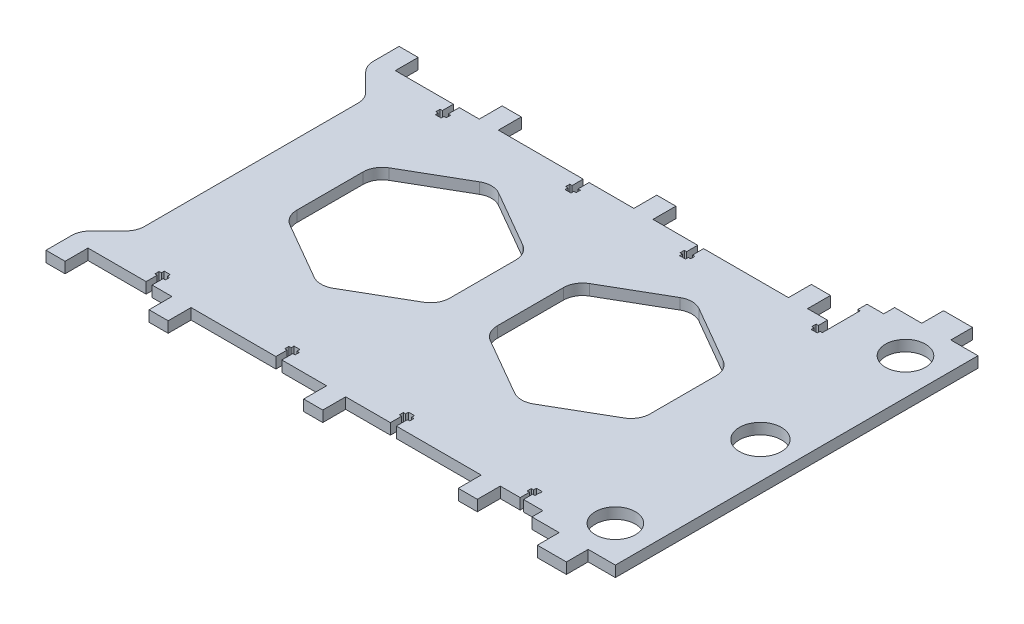
from build123d import *

# Parameters (mm, degrees)
SKETCH_1_R      = 11.052634422
SKETCH_1_R_2    = 11.578950347
EXTRUDE_1_DEPTH = 6


with BuildPart() as part:
    # Эскиз1 → Бобышка-Вытянуть1 (new body)
    with BuildSketch(Plane(origin=(0, 0, 0), x_dir=(1, 0, 0), z_dir=(0, 1, 0))):
        with BuildLine():
            Line((-137.074871228, -68.470853113), (-137.074871228, 49.124679931))
            ThreePointArc((-137.074871228, 49.124679931), (-137.876139291, 53.152928246), (-140.157958535, 56.567912278))
            Line((-140.157958535, 56.567912278), (-149.781267186, 66.191215596))
            ThreePointArc((-149.781267186, 66.191215596), (-152.063084536, 69.606198717), (-152.864352193, 73.634445267))
            Line((-152.864352193, 73.634445267), (-152.86435282, 87.695360009))
            Line((-152.86435282, 87.695360009), (-142.338028676, 87.695360009))
            Line((-142.338028676, 87.695360009), (-142.338028676, 75.063775742))
            Line((-142.338028676, 75.063775742), (-110.285395264, 75.063775742))
            Line((-110.285395264, 75.063775742), (-110.285395264, 68.95850962))
            Line((-110.285395264, 68.95850962), (-111.548551338, 68.95850962))
            Line((-111.548551338, 68.95850962), (-111.548551338, 66.642719563))
            Line((-111.548551338, 66.642719563), (-110.285395264, 66.642719563))
            Line((-110.285395264, 66.642719563), (-110.285395264, 65.063776432))
            Line((-110.285395264, 65.063776432), (-107.022236191, 65.063776432))
            Line((-107.022236191, 65.063776432), (-107.022236191, 66.642719563))
            Line((-107.022236191, 66.642719563), (-105.759080117, 66.642719563))
            Line((-105.759080117, 66.642719563), (-105.759080117, 68.95850962))
            Line((-105.759080117, 68.95850962), (-107.022236191, 68.95850962))
            Line((-107.022236191, 68.95850962), (-107.022236191, 75.063775742))
            Line((-107.022236191, 75.063775742), (-96.022235382, 75.063775742))
            Line((-96.022235382, 75.063775742), (-96.022235382, 87.695360009))
            Line((-96.022235382, 87.695360009), (-85.495911237, 87.695360009))
            Line((-85.495911237, 87.695360009), (-85.495911237, 75.063775742))
            Line((-85.495911237, 75.063775742), (-38.706429514, 75.063775742))
            Line((-38.706429514, 75.063775742), (-38.706429514, 68.95850962))
            Line((-38.706429514, 68.95850962), (-39.969585588, 68.95850962))
            Line((-39.969585588, 68.95850962), (-39.969585588, 66.642719563))
            Line((-39.969585588, 66.642719563), (-38.706429514, 66.642719563))
            Line((-38.706429514, 66.642719563), (-38.706429514, 65.063776432))
            Line((-38.706429514, 65.063776432), (-35.44326848, 65.063776432))
            Line((-35.44326848, 65.063776432), (-35.44326848, 66.642719563))
            Line((-35.44326848, 66.642719563), (-34.180110446, 66.642719563))
            Line((-34.180110446, 66.642719563), (-34.180110446, 68.95850962))
            Line((-34.180110446, 68.95850962), (-35.44326848, 68.95850962))
            Line((-35.44326848, 68.95850962), (-35.44326848, 75.063775742))
            Line((-35.44326848, 75.063775742), (-10.759052362, 75.063775742))
            Line((-10.759052362, 75.063775742), (-10.759052362, 87.695360009))
            Line((-10.759052362, 87.695360009), (-0.2327341, 87.695360009))
            Line((-0.2327341, 87.695360009), (-0.2327341, 75.063775742))
            Line((-0.2327341, 75.063775742), (24.451482019, 75.063775742))
            Line((24.451482019, 75.063775742), (24.451482019, 68.95850962))
            Line((24.451482019, 68.95850962), (23.188323984, 68.95850962))
            Line((23.188323984, 68.95850962), (23.188323984, 66.642719563))
            Line((23.188323984, 66.642719563), (24.451482019, 66.642719563))
            Line((24.451482019, 66.642719563), (24.451482019, 65.063776432))
            Line((24.451482019, 65.063776432), (27.714643053, 65.063776432))
            Line((27.714643053, 65.063776432), (27.714643053, 66.642719563))
            Line((27.714643053, 66.642719563), (28.977799127, 66.642719563))
            Line((28.977799127, 66.642719563), (28.977799127, 68.95850962))
            Line((28.977799127, 68.95850962), (27.714643053, 68.95850962))
            Line((27.714643053, 68.95850962), (27.714643053, 75.063775742))
            Line((27.714643053, 75.063775742), (74.504124776, 75.063775742))
            Line((74.504124776, 75.063775742), (74.504124776, 87.695360009))
            Line((74.504124776, 87.695360009), (85.03044892, 87.695360009))
            Line((85.03044892, 87.695360009), (85.03044892, 75.063775742))
            Line((85.03044892, 75.063775742), (96.03044973, 75.063775742))
            Line((96.03044973, 75.063775742), (96.03044973, 70.011143603))
            Line((96.03044973, 70.011143603), (94.767293656, 70.011143603))
            Line((94.767293656, 70.011143603), (94.767293656, 67.695353546))
            Line((94.767293656, 67.695353546), (96.03044973, 67.695353546))
            Line((96.03044973, 67.695353546), (96.03044973, 66.116402572))
            Line((96.03044973, 66.116402572), (99.293608803, 66.116402572))
            Line((99.293608803, 66.116402572), (99.293608803, 67.695353546))
            Line((99.293608803, 67.695353546), (100.556764877, 67.695353546))
            Line((100.556764877, 67.695353546), (100.556764877, 88.537418761))
            Line((100.556764877, 88.537418761), (99.293608803, 88.537418761))
            Line((99.293608803, 88.537418761), (99.293608803, 93.5900509))
            Line((99.293608803, 93.5900509), (108.504146002, 93.5900509))
            Line((108.504146002, 93.5900509), (108.504146002, 99.5900509))
            Line((108.504146002, 99.5900509), (123.504146002, 99.5900509))
            Line((123.504146002, 99.5900509), (123.504146002, 111.5900509))
            Line((123.504146002, 111.5900509), (139.504146002, 111.5900509))
            Line((139.504146002, 111.5900509), (139.504146002, 99.5900509))
            Line((139.504146002, 99.5900509), (154.504146002, 99.5900509))
            Line((154.504146002, 99.5900509), (154.504146002, -100.4099491))
            Line((154.504146002, -100.4099491), (139.504146002, -100.4099491))
            Line((139.504146002, -100.4099491), (139.504146002, -112.4099491))
            Line((139.504146002, -112.4099491), (123.504146002, -112.4099491))
            Line((123.504146002, -112.4099491), (123.504146002, -100.4099491))
            Line((123.504146002, -100.4099491), (108.504146002, -100.4099491))
            Line((108.504146002, -100.4099491), (108.504146002, -94.4099491))
            Line((108.504146002, -94.4099491), (97.84624566, -94.4099491))
            Line((97.84624566, -94.4099491), (97.84624566, -89.357316962))
            Line((97.84624566, -89.357316962), (99.109401733, -89.357316962))
            Line((99.109401733, -89.357316962), (99.109401733, -87.041526905))
            Line((99.109401733, -87.041526905), (99.293612022, -87.041526905))
            Line((99.293612022, -87.041526905), (99.293612022, -85.462575931))
            Line((99.293612022, -85.462575931), (96.030452949, -85.462575931))
            Line((96.030452949, -85.462575931), (96.030452949, -87.041526905))
            Line((96.030452949, -87.041526905), (94.767296875, -87.041526905))
            Line((94.767296875, -87.041526905), (94.767296875, -89.357316962))
            Line((94.767296875, -89.357316962), (96.030452949, -89.357316962))
            Line((96.030452949, -89.357316962), (96.030452949, -94.4099491))
            Line((96.030452949, -94.4099491), (85.030452139, -94.4099491))
            Line((85.030452139, -94.4099491), (85.030452139, -107.041533368))
            Line((85.030452139, -107.041533368), (74.504127995, -107.041533368))
            Line((74.504127995, -107.041533368), (74.504127995, -94.4099491))
            Line((74.504127995, -94.4099491), (27.714646271, -94.4099491))
            Line((27.714646271, -94.4099491), (27.714646271, -88.304682979))
            Line((27.714646271, -88.304682979), (28.977802345, -88.304682979))
            Line((28.977802345, -88.304682979), (28.977802345, -85.988892922))
            Line((28.977802345, -85.988892922), (27.714646271, -85.988892922))
            Line((27.714646271, -85.988892922), (27.714646271, -84.40994979))
            Line((27.714646271, -84.40994979), (24.451485238, -84.40994979))
            Line((24.451485238, -84.40994979), (24.451485238, -85.988892922))
            Line((24.451485238, -85.988892922), (23.188327203, -85.988892922))
            Line((23.188327203, -85.988892922), (23.188327203, -88.304682979))
            Line((23.188327203, -88.304682979), (24.451485238, -88.304682979))
            Line((24.451485238, -88.304682979), (24.451485238, -94.4099491))
            Line((24.451485238, -94.4099491), (-0.232730881, -94.4099491))
            Line((-0.232730881, -94.4099491), (-0.232730881, -107.041533368))
            Line((-0.232730881, -107.041533368), (-10.759049143, -107.041533368))
            Line((-10.759049143, -107.041533368), (-10.759049143, -94.4099491))
            Line((-10.759049143, -94.4099491), (-35.443265261, -94.4099491))
            Line((-35.443265261, -94.4099491), (-35.443265261, -88.304682979))
            Line((-35.443265261, -88.304682979), (-34.180107227, -88.304682979))
            Line((-34.180107227, -88.304682979), (-34.180107227, -85.988892922))
            Line((-34.180107227, -85.988892922), (-35.443265261, -85.988892922))
            Line((-35.443265261, -85.988892922), (-35.443265261, -84.40994979))
            Line((-35.443265261, -84.40994979), (-38.706426295, -84.40994979))
            Line((-38.706426295, -84.40994979), (-38.706426295, -85.988892922))
            Line((-38.706426295, -85.988892922), (-39.969582369, -85.988892922))
            Line((-39.969582369, -85.988892922), (-39.969582369, -88.304682979))
            Line((-39.969582369, -88.304682979), (-38.706426295, -88.304682979))
            Line((-38.706426295, -88.304682979), (-38.706426295, -94.4099491))
            Line((-38.706426295, -94.4099491), (-85.495908019, -94.4099491))
            Line((-85.495908019, -94.4099491), (-85.495908019, -107.041533368))
            Line((-85.495908019, -107.041533368), (-96.022232163, -107.041533368))
            Line((-96.022232163, -107.041533368), (-96.022232163, -94.4099491))
            Line((-96.022232163, -94.4099491), (-107.022232972, -94.4099491))
            Line((-107.022232972, -94.4099491), (-107.022232972, -88.304682979))
            Line((-107.022232972, -88.304682979), (-105.759076898, -88.304682979))
            Line((-105.759076898, -88.304682979), (-105.759076898, -85.988892922))
            Line((-105.759076898, -85.988892922), (-107.022232972, -85.988892922))
            Line((-107.022232972, -85.988892922), (-107.022232972, -84.40994979))
            Line((-107.022232972, -84.40994979), (-110.285392045, -84.40994979))
            Line((-110.285392045, -84.40994979), (-110.285392045, -85.988892922))
            Line((-110.285392045, -85.988892922), (-111.548548119, -85.988892922))
            Line((-111.548548119, -85.988892922), (-111.548548119, -88.304682979))
            Line((-111.548548119, -88.304682979), (-110.285392045, -88.304682979))
            Line((-110.285392045, -88.304682979), (-110.285392045, -94.4099491))
            Line((-110.285392045, -94.4099491), (-142.338025457, -94.4099491))
            Line((-142.338025457, -94.4099491), (-142.338025457, -107.041533368))
            Line((-142.338025457, -107.041533368), (-152.864349601, -107.041533368))
            Line((-152.864349601, -107.041533368), (-152.864348974, -92.980618626))
            ThreePointArc((-152.864348974, -92.980618626), (-152.063080689, -88.952370933), (-149.781261667, -85.537387435))
            Line((-149.781261667, -85.537387435), (-140.157958535, -75.914084303))
            ThreePointArc((-140.157958535, -75.914084303), (-137.876139513, -72.499100806), (-137.074871228, -68.470853113))
        make_face()
        with Locations((134.504146002, 79.5900509)):
            Circle(SKETCH_1_R, mode=Mode.SUBTRACT)
        with Locations((134.504146002, -80.4099491)):
            Circle(SKETCH_1_R, mode=Mode.SUBTRACT)
        with Locations((134.504146002, -0.4099491)):
            Circle(SKETCH_1_R_2, mode=Mode.SUBTRACT)
        with BuildLine():
            Line((-23.916948741, 26.938229251), (-55.495903408, 45.170347229))
            ThreePointArc((-55.495903408, 45.170347229), (-60.759062907, 46.580606949), (-66.022222533, 45.170347705))
            Line((-66.022222533, 45.170347705), (-97.601176456, 26.938228368))
            ThreePointArc((-97.601176456, 26.938228368), (-101.454076716, 23.085328612), (-102.864336112, 17.822169354))
            Line((-102.864336112, 17.822169354), (-102.864337366, -18.642067619))
            ThreePointArc((-102.864337366, -18.642067619), (-101.454077996, -23.905227145), (-97.601177804, -27.758127325))
            Line((-97.601177804, -27.758127325), (-66.02222349, -45.990245099))
            ThreePointArc((-66.02222349, -45.990245099), (-60.759063783, -47.400505038), (-55.495903895, -45.990245779))
            Line((-55.495903895, -45.990245779), (-23.916948481, -27.758126442))
            ThreePointArc((-23.916948481, -27.758126442), (-20.06404888, -23.905226635), (-18.653789757, -18.642067749))
            Line((-18.653789757, -18.642067749), (-18.653789757, 17.822169158))
            ThreePointArc((-18.653789757, 17.822169158), (-20.064048696, 23.085328852), (-23.916948741, 26.938229251))
        make_face(mode=Mode.SUBTRACT)
        with BuildLine():
            Line((12.925167359, -27.758126781), (44.504122026, -45.990244759))
            ThreePointArc((44.504122026, -45.990244759), (49.767281524, -47.400504479), (55.03044115, -45.990245235))
            Line((55.03044115, -45.990245235), (86.609395074, -27.758125898))
            ThreePointArc((86.609395074, -27.758125898), (90.462295333, -23.905226142), (91.872554729, -18.642066883))
            Line((91.872554729, -18.642066883), (91.872555984, 17.822170089))
            ThreePointArc((91.872555984, 17.822170089), (90.462296282, 23.08532917), (86.609396157, 26.938228929))
            Line((86.609396157, 26.938228929), (55.030441843, 45.170346703))
            ThreePointArc((55.030441843, 45.170346703), (49.767282136, 46.580606642), (44.504122247, 45.170347383))
            Line((44.504122247, 45.170347383), (12.925166834, 26.938228046))
            ThreePointArc((12.925166834, 26.938228046), (9.072267233, 23.08532824), (7.66200811, 17.822169354))
            Line((7.66200811, 17.822169354), (7.66200811, -18.642067554))
            ThreePointArc((7.66200811, -18.642067554), (9.07226738, -23.905226803), (12.925167359, -27.758126781))
        make_face(mode=Mode.SUBTRACT)
    extrude(amount=EXTRUDE_1_DEPTH)


solid = part.part
